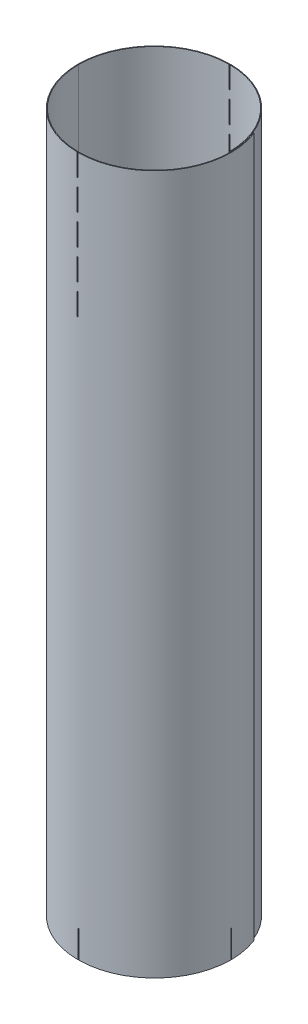
from build123d import *

# Parameters (mm, degrees)
BASE_FLANGE1_DEPTH   = 255
UNFOLD1_START        = -255
UNFOLD1_DEPTH        = 255
UNFOLD1_2_DEPTH      = 255
SKETCH6_W            = 0.3
SKETCH6_H            = 8
CUT_EXTRUDE1_DEPTH   = 315.779958422
LPATTERN1_COUNT      = 2
LPATTERN1_PITCH      = 86.9
LPATTERN1_COUNT_DIR2 = 5
LPATTERN1_PITCH_DIR2 = 11
SKETCH7_W            = 0.3
SKETCH7_H            = 10
CUT_EXTRUDE2_DEPTH   = 315.779958422
LPATTERN2_COUNT      = 5
LPATTERN2_PITCH      = 43.4969
FOLD1_START          = -255
FOLD1_DEPTH          = 255
FOLD1_2_DEPTH        = 10
FOLD1_3_DEPTH        = 255
FOLD1_START_2        = -245
FOLD1_4_DEPTH        = 193
FOLD1_START_3        = -52
FOLD1_5_DEPTH        = 52
FOLD1_6_DEPTH        = 10
FOLD1_START_4        = -44
FOLD1_7_DEPTH        = 3
FOLD1_START_5        = -33
FOLD1_8_DEPTH        = 3
FOLD1_START_6        = -22
FOLD1_9_DEPTH        = 3
FOLD1_START_7        = -11
FOLD1_10_DEPTH       = 3


# Read off the part's stored shape, not the designer's step: Unfold1, Fold1
# Sheet-metal steps are written as plain solids
with BuildPart() as part:
    # Sketch1 → Base-Flange1 (new body)
    with BuildSketch(Plane(origin=(0, 0, 0), x_dir=(1, 0, 0), z_dir=(0, 1, 0))):
        with BuildLine():
            ThreePointArc((27.5, 0), (0, 27.5), (-27.5, 0))
            ThreePointArc((-27.5, 0), (5.334991298, -27.197244319), (25.943416257, 10.127272727))
            Line((25.943416257, 10.127272727), (26.176084396, 10.21873604))
            ThreePointArc((26.176084396, 10.21873604), (5.381536789, -27.442873139), (-27.75, 0))
            ThreePointArc((-27.75, 0), (0, 27.75), (27.75, 0))
            Line((27.75, 0), (27.5, 0))
        make_face()
    extrude(amount=-BASE_FLANGE1_DEPTH)

    # Unfold1 outline → Unfold1 (cut)
    with BuildSketch(Plane(origin=(0, 0, 0), x_dir=(1, 0, 0), z_dir=(0, 1, 0)).offset(UNFOLD1_START)):
        with BuildLine():
            Line((27.5, 4.465057679), (27.5, 5.81720394))
            ThreePointArc((27.5, 5.81720394), (26.928734746, 8.045248964), (26.176084396, 10.21873604))
            Line((26.176084396, 10.21873604), (25.943416257, 10.127272727))
            ThreePointArc((25.943416257, 10.127272727), (26.872280055, 7.337558511), (27.5, 4.465057679))
        make_face()
        with BuildLine():
            ThreePointArc((-27.75, 0), (2.431208617, -27.840474058), (27.75, 4.485307483))
            Line((27.75, 4.485307483), (27.75, 2.492962419))
            ThreePointArc((27.75, 2.492962419), (1.428992542, -27.653107247), (-27.5, 0))
            ThreePointArc((-27.5, 0), (0, 27.5), (27.5, 0))
            Line((27.5, 0), (27.5, 3.716517187))
            ThreePointArc((27.5, 3.716517187), (-1.862458053, 27.687429458), (-27.75, 0))
        make_face()
    extrude(amount=UNFOLD1_DEPTH, mode=Mode.SUBTRACT)

    # Unfold1 2 outline → Unfold1 2 (add)
    with BuildSketch(Plane(origin=(0, 0, 0), x_dir=(1, 0, 0), z_dir=(0, 1, 0)).offset(UNFOLD1_START)):
        with BuildLine():
            Line((27.5, 184.557199058), (27.5, 5.81720394))
            ThreePointArc((27.5, 5.81720394), (27.633078737, 5.152772109), (27.75, 4.485307483))
            Line((27.75, 4.485307483), (27.75, 184.557199058))
            Line((27.75, 184.557199058), (27.5, 184.557199058))
        make_face()
        with BuildLine():
            ThreePointArc((27.75, 2.492962419), (27.642708515, 3.481254935), (27.5, 4.465057679))
            Line((27.5, 4.465057679), (27.5, 3.716517187))
            ThreePointArc((27.5, 3.716517187), (27.687429458, 1.862458053), (27.75, 0))
            Line((27.75, 0), (27.75, 2.492962419))
        make_face()
    extrude(amount=UNFOLD1_2_DEPTH)

    # Sketch6 → Cut-Extrude1 (cut, through all)
    with BuildSketch(Plane(origin=(27.75, 0, 0), x_dir=(0, 0, -1), z_dir=(1, 0, 0))):
        with Locations((43.35, -4)):
            Rectangle(SKETCH6_W, SKETCH6_H)
    cut_extrude1 = extrude(amount=-CUT_EXTRUDE1_DEPTH, mode=Mode.SUBTRACT)

    # LPattern1: Cut-Extrude1 2 × 5
    with Locations(*[(0, -j * LPATTERN1_PITCH_DIR2, -i * LPATTERN1_PITCH) for i in range(LPATTERN1_COUNT) for j in range(LPATTERN1_COUNT_DIR2) if (i, j) != (0, 0)]):
        add(cut_extrude1, mode=Mode.SUBTRACT)

    # Sketch7 → Cut-Extrude2 (cut, through all)
    with BuildSketch(Plane(origin=(27.75, 0, 0), x_dir=(0, 0, -1), z_dir=(1, 0, 0))):
        with Locations((0.15, -250)):
            Rectangle(SKETCH7_W, SKETCH7_H)
    cut_extrude2 = extrude(amount=-CUT_EXTRUDE2_DEPTH, mode=Mode.SUBTRACT)

    # LPattern2: Cut-Extrude2 ×5
    with Locations(*[(0, 0, -i * LPATTERN2_PITCH) for i in range(1, LPATTERN2_COUNT)]):
        add(cut_extrude2, mode=Mode.SUBTRACT)

    # Fold1 outline → Fold1 (cut)
    with BuildSketch(Plane(origin=(0, 0, 0), x_dir=(1, 0, 0), z_dir=(0, 1, 0)).offset(FOLD1_START)):
        with BuildLine():
            Line((27.5, 4.465057679), (27.5, 3.716517187))
            ThreePointArc((27.5, 3.716517187), (27.687429458, 1.862458053), (27.75, 0))
            Line((27.75, 0), (27.75, 2.492962419))
            ThreePointArc((27.75, 2.492962419), (27.642708515, 3.481254935), (27.5, 4.465057679))
        make_face()
        with BuildLine():
            ThreePointArc((27.5, 5.81720394), (27.633078737, 5.152772109), (27.75, 4.485307483))
            Line((27.75, 4.485307483), (27.75, 184.557199058))
            Line((27.75, 184.557199058), (27.5, 184.557199058))
            Line((27.5, 184.557199058), (27.5, 5.81720394))
        make_face()
    extrude(amount=FOLD1_DEPTH, mode=Mode.SUBTRACT)

    # Fold1 2 outline → Fold1 2 (cut)
    with BuildSketch(Plane(origin=(0, 0, 0), x_dir=(1, 0, 0), z_dir=(0, 1, 0)).offset(FOLD1_START)):
        with BuildLine():
            ThreePointArc((27.748378331, 0.3), (27.748371017, 0.300675772), (27.748363686, 0.301351543))
            Line((27.748363686, 0.301351543), (27.623914005, 0.3))
            Line((27.623914005, 0.3), (27.748378331, 0.3))
        make_face()
    extrude(amount=FOLD1_2_DEPTH, mode=Mode.SUBTRACT)

    # Fold1 3 outline → Fold1 3 (add)
    with BuildSketch(Plane(origin=(0, 0, 0), x_dir=(1, 0, 0), z_dir=(0, 1, 0)).offset(FOLD1_START)):
        with BuildLine():
            Line((0.194121372, 27.749321017), (0.192372531, 27.499327134))
            ThreePointArc((0.192372531, 27.499327134), (19.407828644, 19.482971727), (27.498378428, 0.298636664))
            Line((27.498378428, 0.298636664), (27.623914005, 0.3))
            Line((27.623914005, 0.3), (27.5, 0.3))
            Line((27.5, 0.3), (27.5, 3.716517187))
            ThreePointArc((27.5, 3.716517187), (18.333984963, 20.830926417), (0.194121372, 27.749321017))
        make_face()
        with BuildLine():
            ThreePointArc((25.943416257, 10.127272727), (26.872280055, 7.337558511), (27.5, 4.465057679))
            Line((27.5, 4.465057679), (27.5, 5.81720394))
            ThreePointArc((27.5, 5.81720394), (26.928734746, 8.045248964), (26.176084396, 10.21873604))
            Line((26.176084396, 10.21873604), (25.943416257, 10.127272727))
        make_face()
        with BuildLine():
            ThreePointArc((-27.5, 0), (-19.586982848, 19.302852196), (-0.401810697, 27.497064355))
            Line((-0.401810697, 27.497064355), (-0.405463521, 27.747037668))
            ThreePointArc((-0.405463521, 27.747037668), (-19.765046328, 19.478332671), (-27.75, 0))
            ThreePointArc((-27.75, 0), (-27.749805944, -0.104117185), (-27.74922378, -0.208232924))
            Line((-27.74922378, -0.208232924), (-27.499230728, -0.206369125))
            ThreePointArc((-27.499230728, -0.206369125), (-27.499807681, -0.103185279), (-27.5, 0))
        make_face()
        with BuildLine():
            Line((27.75, 4.485307483), (27.75, 2.492962419))
            ThreePointArc((27.75, 2.492962419), (27.830997978, 1.319952212), (27.86210871, 0.144560473))
            Line((27.86210871, 0.144560473), (28.112105301, 0.145866054))
            ThreePointArc((28.112105301, 0.145866054), (28.015747193, 2.322654117), (27.75, 4.485307483))
        make_face()
        with BuildLine():
            Line((28.112053433, -0.155481098), (27.862057305, -0.154089457))
            ThreePointArc((27.862057305, -0.154089457), (19.815096757, -19.513149653), (0.506027414, -27.679337678))
            Line((0.506027414, -27.679337678), (0.508960666, -27.929320469))
            ThreePointArc((0.508960666, -27.929320469), (19.992417674, -19.689380446), (28.112053433, -0.155481098))
        make_face()
        with BuildLine():
            ThreePointArc((-0.181549779, -27.678865592), (-19.342005015, -19.623812129), (-27.49539326, -0.504994403))
            Line((-27.49539326, -0.504994403), (-27.745351655, -0.509555202))
            ThreePointArc((-27.745351655, -0.509555202), (-19.518327011, -19.801042357), (-0.184826302, -27.92884412))
            Line((-0.184826302, -27.92884412), (-0.181549779, -27.678865592))
        make_face()
        with BuildLine():
            Line((0.207619564, -27.931230638), (0.20738348, -27.681230749))
            ThreePointArc((0.20738348, -27.681230749), (0.162237351, -27.681236567), (0.117091273, -27.681168755))
            Line((0.117091273, -27.681168755), (0.116511894, -27.931168084))
            ThreePointArc((0.116511894, -27.931168084), (0.162065703, -27.931236508), (0.207619564, -27.931230638))
        make_face()
    extrude(amount=FOLD1_3_DEPTH)

    # Fold1 4 outline → Fold1 4 (add)
    with BuildSketch(Plane(origin=(0, 0, 0), x_dir=(1, 0, 0), z_dir=(0, 1, 0)).offset(FOLD1_START_2)):
        with BuildLine():
            Line((0.192372531, 27.499327134), (0.194121372, 27.749321017))
            ThreePointArc((0.194121372, 27.749321017), (-0.105677242, 27.74979878), (-0.405463521, 27.747037668))
            Line((-0.405463521, 27.747037668), (-0.401810697, 27.497064355))
            ThreePointArc((-0.401810697, 27.497064355), (-0.104725195, 27.499800593), (0.192372531, 27.499327134))
        make_face()
        with BuildLine():
            Line((27.5, 0.298654275), (27.498378428, 0.298636664))
            ThreePointArc((27.498378428, 0.298636664), (27.499594604, 0.149320533), (27.5, 0))
            Line((27.5, 0), (27.5, 0.298654275))
        make_face()
        with BuildLine():
            Line((28.112105301, 0.145866054), (27.86210871, 0.144560473))
            ThreePointArc((27.86210871, 0.144560473), (27.862485773, -0.004764561), (27.862057305, -0.154089457))
            Line((27.862057305, -0.154089457), (28.112053433, -0.155481098))
            ThreePointArc((28.112053433, -0.155481098), (28.11248577, -0.004807592), (28.112105301, 0.145866054))
        make_face()
        with BuildLine():
            ThreePointArc((-27.49539326, -0.504994403), (-27.497714727, -0.355686939), (-27.499230728, -0.206369125))
            Line((-27.499230728, -0.206369125), (-27.74922378, -0.208232924))
            ThreePointArc((-27.74922378, -0.208232924), (-27.747694087, -0.358899285), (-27.745351655, -0.509555202))
            Line((-27.745351655, -0.509555202), (-27.49539326, -0.504994403))
        make_face()
        with BuildLine():
            Line((0.508960666, -27.929320469), (0.506027414, -27.679337678))
            ThreePointArc((0.506027414, -27.679337678), (0.356708, -27.680686971), (0.20738348, -27.681230749))
            Line((0.20738348, -27.681230749), (0.207619564, -27.931230638))
            ThreePointArc((0.207619564, -27.931230638), (0.358292691, -27.930681948), (0.508960666, -27.929320469))
        make_face()
        with BuildLine():
            ThreePointArc((0.117091273, -27.681168755), (-0.032232359, -27.680419927), (-0.181549779, -27.678865592))
            Line((-0.181549779, -27.678865592), (-0.184826302, -27.92884412))
            ThreePointArc((-0.184826302, -27.92884412), (-0.034160338, -27.930412493), (0.116511894, -27.931168084))
            Line((0.116511894, -27.931168084), (0.117091273, -27.681168755))
        make_face()
    extrude(amount=FOLD1_4_DEPTH)

    # Fold1 5 outline → Fold1 5 (add)
    with BuildSketch(Plane(origin=(0, 0, 0), x_dir=(1, 0, 0), z_dir=(0, 1, 0)).offset(FOLD1_START_3)):
        with BuildLine():
            Line((27.5, 0.298654275), (27.498378428, 0.298636664))
            ThreePointArc((27.498378428, 0.298636664), (27.499594604, 0.149320533), (27.5, 0))
            Line((27.5, 0), (27.5, 0.298654275))
        make_face()
        with BuildLine():
            ThreePointArc((-0.401810697, 27.497064355), (-0.254043101, 27.498826559), (-0.106268169, 27.499794673))
            Line((-0.106268169, 27.499794673), (-0.107234244, 27.749792807))
            ThreePointArc((-0.107234244, 27.749792807), (-0.256352584, 27.748815891), (-0.405463521, 27.747037668))
            Line((-0.405463521, 27.747037668), (-0.401810697, 27.497064355))
        make_face()
        with BuildLine():
            Line((28.112105301, 0.145866054), (27.86210871, 0.144560473))
            ThreePointArc((27.86210871, 0.144560473), (27.862485773, -0.004764561), (27.862057305, -0.154089457))
            Line((27.862057305, -0.154089457), (28.112053433, -0.155481098))
            ThreePointArc((28.112053433, -0.155481098), (28.11248577, -0.004807592), (28.112105301, 0.145866054))
        make_face()
        with BuildLine():
            ThreePointArc((-27.49539326, -0.504994403), (-27.497714727, -0.355686939), (-27.499230728, -0.206369125))
            Line((-27.499230728, -0.206369125), (-27.74922378, -0.208232924))
            ThreePointArc((-27.74922378, -0.208232924), (-27.747694087, -0.358899285), (-27.745351655, -0.509555202))
            Line((-27.745351655, -0.509555202), (-27.49539326, -0.504994403))
        make_face()
        with BuildLine():
            Line((0.508960666, -27.929320469), (0.506027414, -27.679337678))
            ThreePointArc((0.506027414, -27.679337678), (0.356708, -27.680686971), (0.20738348, -27.681230749))
            Line((0.20738348, -27.681230749), (0.207619564, -27.931230638))
            ThreePointArc((0.207619564, -27.931230638), (0.358292691, -27.930681948), (0.508960666, -27.929320469))
        make_face()
    extrude(amount=FOLD1_5_DEPTH)

    # Fold1 6 outline → Fold1 6 (add)
    with BuildSketch(Plane(origin=(0, 0, 0), x_dir=(1, 0, 0), z_dir=(0, 1, 0)).offset(FOLD1_START)):
        with BuildLine():
            ThreePointArc((-0.103182219, 27.499806425), (0.0445958, 27.49996384), (0.192372531, 27.499327134))
            Line((0.192372531, 27.499327134), (0.194121372, 27.749321017))
            ThreePointArc((0.194121372, 27.749321017), (0.045001216, 27.749963512), (-0.104120239, 27.749804666))
            Line((-0.104120239, 27.749804666), (-0.103182219, 27.499806425))
        make_face()
        with BuildLine():
            ThreePointArc((0.117091273, -27.681168755), (-0.032232359, -27.680419927), (-0.181549779, -27.678865592))
            Line((-0.181549779, -27.678865592), (-0.184826302, -27.92884412))
            ThreePointArc((-0.184826302, -27.92884412), (-0.034160338, -27.930412493), (0.116511894, -27.931168084))
            Line((0.116511894, -27.931168084), (0.117091273, -27.681168755))
        make_face()
    extrude(amount=FOLD1_6_DEPTH)

    # Fold1 7 outline → Fold1 7 (add)
    with BuildSketch(Plane(origin=(0, 0, 0), x_dir=(1, 0, 0), z_dir=(0, 1, 0)).offset(FOLD1_START_4)):
        with BuildLine():
            Line((0.192372531, 27.499327134), (0.194121372, 27.749321017))
            ThreePointArc((0.194121372, 27.749321017), (0.043444204, 27.749965993), (-0.107234244, 27.749792807))
            Line((-0.107234244, 27.749792807), (-0.106268169, 27.499794673))
            ThreePointArc((-0.106268169, 27.499794673), (0.043052816, 27.499966299), (0.192372531, 27.499327134))
        make_face()
        with BuildLine():
            ThreePointArc((0.117091273, -27.681168755), (-0.032232359, -27.680419927), (-0.181549779, -27.678865592))
            Line((-0.181549779, -27.678865592), (-0.184826302, -27.92884412))
            ThreePointArc((-0.184826302, -27.92884412), (-0.034160338, -27.930412493), (0.116511894, -27.931168084))
            Line((0.116511894, -27.931168084), (0.117091273, -27.681168755))
        make_face()
    extrude(amount=FOLD1_7_DEPTH)

    # Fold1 8 outline → Fold1 8 (add)
    with BuildSketch(Plane(origin=(0, 0, 0), x_dir=(1, 0, 0), z_dir=(0, 1, 0)).offset(FOLD1_START_5)):
        with BuildLine():
            Line((0.192372531, 27.499327134), (0.194121372, 27.749321017))
            ThreePointArc((0.194121372, 27.749321017), (0.043444204, 27.749965993), (-0.107234244, 27.749792807))
            Line((-0.107234244, 27.749792807), (-0.106268169, 27.499794673))
            ThreePointArc((-0.106268169, 27.499794673), (0.043052816, 27.499966299), (0.192372531, 27.499327134))
        make_face()
        with BuildLine():
            ThreePointArc((0.117091273, -27.681168755), (-0.032232359, -27.680419927), (-0.181549779, -27.678865592))
            Line((-0.181549779, -27.678865592), (-0.184826302, -27.92884412))
            ThreePointArc((-0.184826302, -27.92884412), (-0.034160338, -27.930412493), (0.116511894, -27.931168084))
            Line((0.116511894, -27.931168084), (0.117091273, -27.681168755))
        make_face()
    extrude(amount=FOLD1_8_DEPTH)

    # Fold1 9 outline → Fold1 9 (add)
    with BuildSketch(Plane(origin=(0, 0, 0), x_dir=(1, 0, 0), z_dir=(0, 1, 0)).offset(FOLD1_START_6)):
        with BuildLine():
            Line((0.192372531, 27.499327134), (0.194121372, 27.749321017))
            ThreePointArc((0.194121372, 27.749321017), (0.043444204, 27.749965993), (-0.107234244, 27.749792807))
            Line((-0.107234244, 27.749792807), (-0.106268169, 27.499794673))
            ThreePointArc((-0.106268169, 27.499794673), (0.043052816, 27.499966299), (0.192372531, 27.499327134))
        make_face()
        with BuildLine():
            ThreePointArc((0.117091273, -27.681168755), (-0.032232359, -27.680419927), (-0.181549779, -27.678865592))
            Line((-0.181549779, -27.678865592), (-0.184826302, -27.92884412))
            ThreePointArc((-0.184826302, -27.92884412), (-0.034160338, -27.930412493), (0.116511894, -27.931168084))
            Line((0.116511894, -27.931168084), (0.117091273, -27.681168755))
        make_face()
    extrude(amount=FOLD1_9_DEPTH)

    # Fold1 10 outline → Fold1 10 (add)
    with BuildSketch(Plane(origin=(0, 0, 0), x_dir=(1, 0, 0), z_dir=(0, 1, 0)).offset(FOLD1_START_7)):
        with BuildLine():
            Line((0.192372531, 27.499327134), (0.194121372, 27.749321017))
            ThreePointArc((0.194121372, 27.749321017), (0.043444204, 27.749965993), (-0.107234244, 27.749792807))
            Line((-0.107234244, 27.749792807), (-0.106268169, 27.499794673))
            ThreePointArc((-0.106268169, 27.499794673), (0.043052816, 27.499966299), (0.192372531, 27.499327134))
        make_face()
        with BuildLine():
            ThreePointArc((0.117091273, -27.681168755), (-0.032232359, -27.680419927), (-0.181549779, -27.678865592))
            Line((-0.181549779, -27.678865592), (-0.184826302, -27.92884412))
            ThreePointArc((-0.184826302, -27.92884412), (-0.034160338, -27.930412493), (0.116511894, -27.931168084))
            Line((0.116511894, -27.931168084), (0.117091273, -27.681168755))
        make_face()
    extrude(amount=FOLD1_10_DEPTH)


solid = part.part
